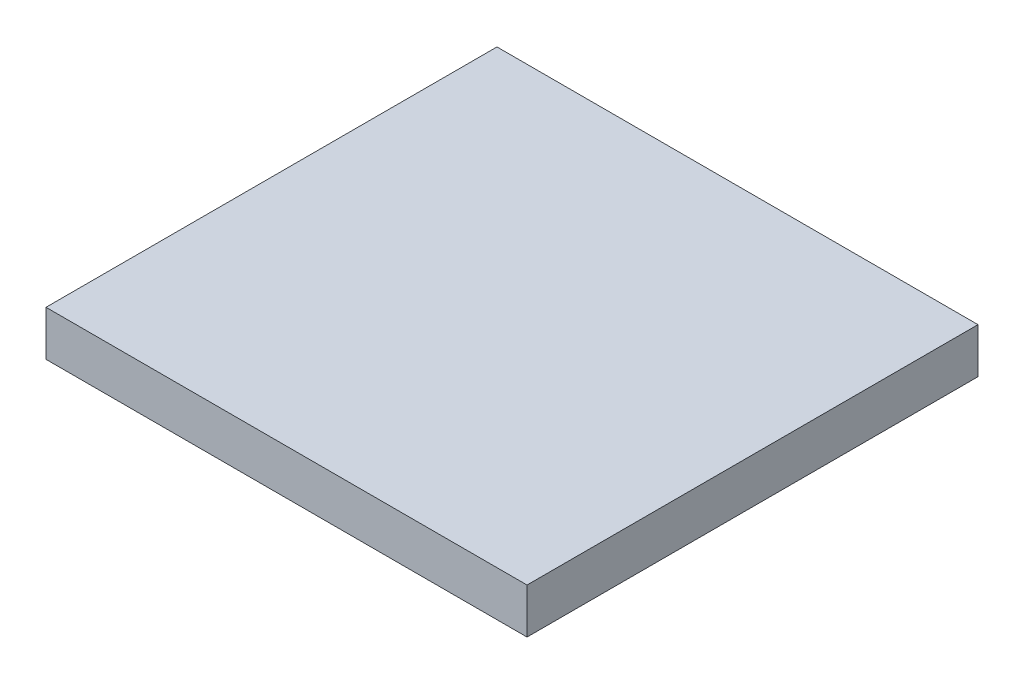
from build123d import *

# Parameters (mm, degrees)
SKETCH1_W           = 16
SKETCH1_H           = 15
BOSS_EXTRUDE1_DEPTH = 1.5


with BuildPart() as part:
    # Sketch1 → Boss-Extrude1 (new body)
    with BuildSketch(Plane(origin=(0, 0, 0), x_dir=(1, 0, 0), z_dir=(0, 1, 0))):
        Rectangle(SKETCH1_W, SKETCH1_H)
    extrude(amount=BOSS_EXTRUDE1_DEPTH)


solid = part.part
